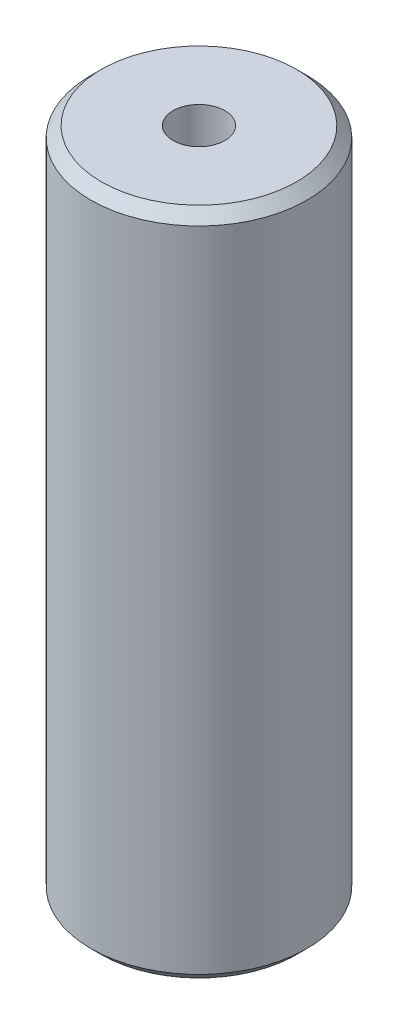
from build123d import *

# Parameters (mm, degrees)
SKETCH1_R           = 7.5
BOSS_EXTRUDE1_DEPTH = 46.444364828
SKETCH2_R           = 1.799501063
CUT_EXTRUDE1_DEPTH  = 48.640098911
CHAMFER1_SIZE       = 0.732865129


with BuildPart() as part:
    # Sketch1 → Boss-Extrude1 (new body)
    with BuildSketch(Plane(origin=(0, 0, 0), x_dir=(1, 0, 0), z_dir=(0, 1, 0))):
        Circle(SKETCH1_R)
    extrude(amount=BOSS_EXTRUDE1_DEPTH)

    # Sketch2 → Cut-Extrude1 (cut, through all)
    with BuildSketch(Plane(origin=(0, 0, 0), x_dir=(1, 0, 0), z_dir=(0, 1, 0))):
        Circle(SKETCH2_R)
    extrude(amount=CUT_EXTRUDE1_DEPTH, mode=Mode.SUBTRACT)

    # Chamfer1
    chamfer1_edges = [part.edges().sort_by_distance(p)[0] for p in [
        (-7.5, 46.444364828, 0),
        (-7.5, 0, 0),
    ]]
    chamfer(chamfer1_edges, length=CHAMFER1_SIZE)


solid = part.part
